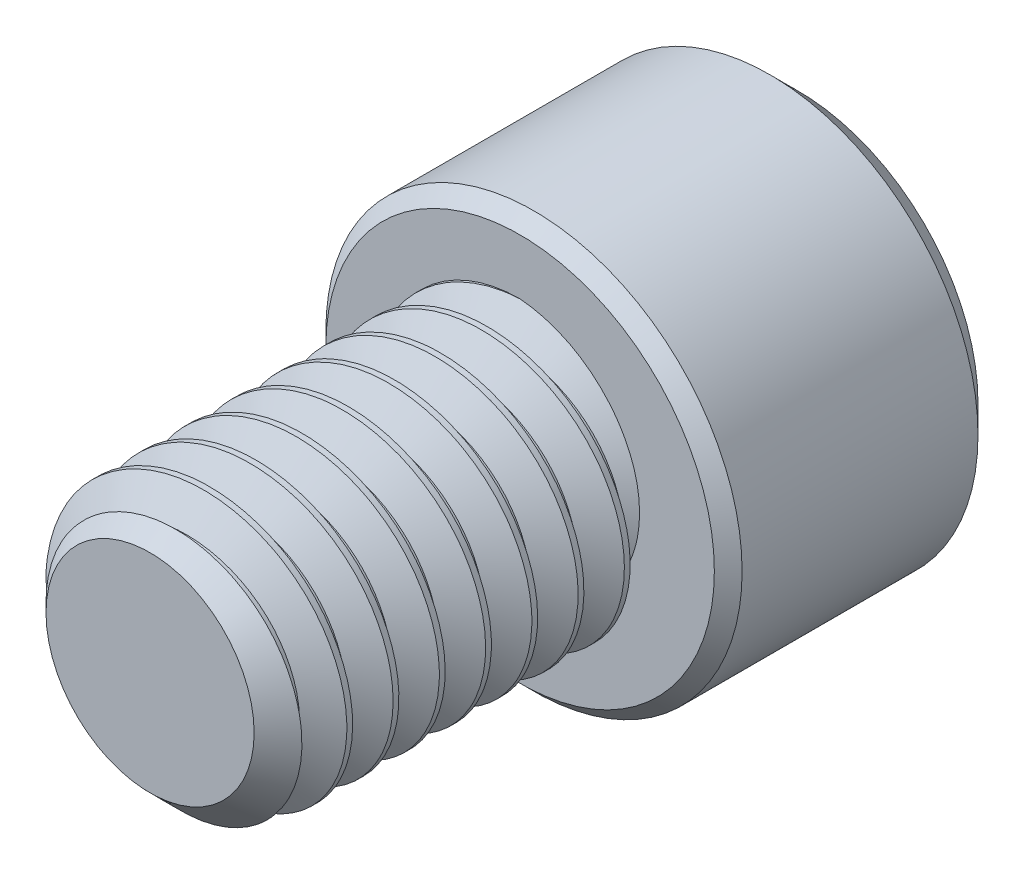
from build123d import *

# Parameters (mm, degrees)
SKETCH1_R          = 4.7625
EXTRUDE1_DEPTH     = 12.7
CHAMFER3_SIZE      = 1.190625
CUT_SWEEP1_PITCH   = 1.5875
SKETCH6_R          = 7.14375
EXTRUDE2_DEPTH     = 9.525
CUT_EXTRUDE1_DEPTH = 5.953125
SKETCH8_R          = 4.582717762
CUT_EXTRUDE2_DEPTH = 0.9525
CUT_EXTRUDE2_DRAFT = -45
CHAMFER1_SIZE      = 0.9525
CHAMFER2_SIZE      = 0.47625


with BuildPart() as part:
    # Sketch1 → Extrude1 (new body)
    with BuildSketch(Plane.XY):
        Circle(SKETCH1_R)
    extrude(amount=-EXTRUDE1_DEPTH)

    # Chamfer3
    chamfer3_edges = [part.edges().sort_by_distance(p)[0] for p in [
        (-4.7625, 0, 0),
    ]]
    chamfer(chamfer3_edges, length=CHAMFER3_SIZE)

    # Cut-Sweep1: the profile of Sketch3 profile screwed along a right-hand helix of 9 turns, 6 arcs to a turn; built about Z, then put on its axis
    cut_sweep1_z = Axis((0, 0, 0), (0, 0, 1))
    cut_sweep1_corners = [(4.7628, 0, -1.389235705), (3.731388504, 0, -0.79375), (3.731388504, 0, -0.5953125), (4.7628, 0, 0.000173205)]
    with BuildLine(mode=Mode.PRIVATE) as cut_sweep1_profile:
        Line(cut_sweep1_corners[0], cut_sweep1_corners[1])
        Line(cut_sweep1_corners[1], cut_sweep1_corners[2])
        Line(cut_sweep1_corners[2], cut_sweep1_corners[3])
        Line(cut_sweep1_corners[3], cut_sweep1_corners[0])
    cut_sweep1_cap = Face(cut_sweep1_profile.wire())
    cut_sweep1_turn_angles = [0, 30, 60, 90, 120, 150, 180, 210, 240, 270, 300, 330, 360]
    cut_sweep1_turn_weights = [1, 0.8660254037844387, 1, 0.8660254037844387, 1, 0.8660254037844387, 1, 0.8660254037844387, 1, 0.8660254037844387, 1, 0.8660254037844387, 1]
    cut_sweep1_turn_rails = [Edge.make_bspline([Vector(p[0], p[1], 0).rotate(cut_sweep1_z, cut_sweep1_turn_angles[k]) / cut_sweep1_turn_weights[k] + Vector(0, 0, p[2] + CUT_SWEEP1_PITCH * cut_sweep1_turn_angles[k] / 360) for k in range(13)], [0, 0, 0, 1, 1, 2, 2, 3, 3, 4, 4, 5, 5, 6, 6, 6], 2, cut_sweep1_turn_weights) for p in cut_sweep1_corners]
    cut_sweep1_turn_sides = [Face.make_surface_from_curves(cut_sweep1_turn_rails[p[0]], cut_sweep1_turn_rails[p[1]]) for p in [(0, 1), (1, 2), (2, 3), (3, 0)]]
    cut_sweep1 = Plane(origin=(0, 0, 0), x_dir=(0, 1, 0), z_dir=(0, 0, -1)) * Solid(Shell([*[p.moved(Location((0, 0, CUT_SWEEP1_PITCH * i))) for i in range(9) for p in cut_sweep1_turn_sides], cut_sweep1_cap, cut_sweep1_cap.rotate(cut_sweep1_z, 3240).moved(Location((0, 0, CUT_SWEEP1_PITCH * 3240 / 360)))]))
    add(cut_sweep1, mode=Mode.SUBTRACT)

    # Sketch6 → Extrude2 (add)
    with BuildSketch(Plane(origin=(0, 0, -12.7), x_dir=(-1, 0, 0), z_dir=(0, 0, -1))):
        with Locations(Location((0, 0, 0), (0, 0, 180))):
            Circle(SKETCH6_R)
    extrude(amount=EXTRUDE2_DEPTH)

    # Sketch7 → Cut-Extrude1 (cut)
    with BuildSketch(Plane(origin=(0, 0, -22.225), x_dir=(-1, 0, 0), z_dir=(0, 0, -1))):
        Polygon((0, 4.582717762), (-3.96875, 2.291358881), (-3.96875, -2.291358881), (0, -4.582717762), (3.96875, -2.291358881), (3.96875, 2.291358881), align=None)
    extrude(amount=-CUT_EXTRUDE1_DEPTH, mode=Mode.SUBTRACT)


with BuildPart() as cut_extrude2_tool:
    # Sketch8 → Cut-Extrude2 (with draft: the straight prism first)
    with BuildSketch(Plane(origin=(0, 0, -22.225), x_dir=(-1, 0, 0), z_dir=(0, 0, -1))):
        Circle(SKETCH8_R)
    extrude(amount=-CUT_EXTRUDE2_DEPTH)
    # Cut-Extrude2: the draft: its side faces are tilted about the plane it starts from
    cut_extrude2_sides = [cut_extrude2_tool.faces().sort_by_distance(p)[0] for p in [
        (4.582717762, 0, -21.74875),
    ]]
    draft(cut_extrude2_sides, Plane(origin=(0, 0, -22.225), x_dir=(-1, 0, 0), z_dir=(0, 0, -1)), CUT_EXTRUDE2_DRAFT)


with BuildPart() as part_1:
    add(part.part)

    # Cut-Extrude2: cut by cut_extrude2_tool
    add(cut_extrude2_tool.part, mode=Mode.SUBTRACT)

    # Chamfer1
    chamfer1_edges = [part_1.edges().sort_by_distance(p)[0] for p in [
        (-7.14375, 0, -22.225),
    ]]
    chamfer(chamfer1_edges, length=CHAMFER1_SIZE)

    # Chamfer2
    chamfer2_edges = [part_1.edges().sort_by_distance(p)[0] for p in [
        (-7.14375, 0, -12.7),
    ]]
    chamfer(chamfer2_edges, length=CHAMFER2_SIZE)


solid = part_1.part
